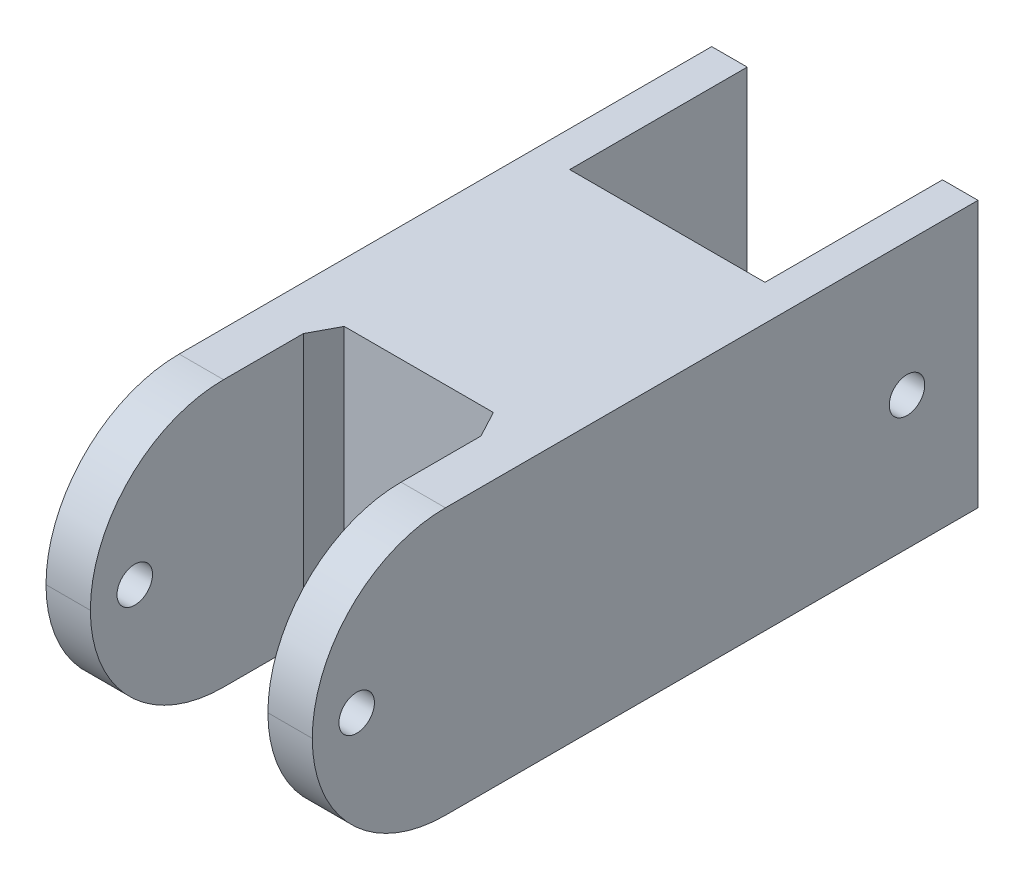
from build123d import *

# Parameters (mm, degrees)
SKETCH1_W                  = 38.1
SKETCH1_H                  = 38.1
PRONG_HOLDERS_DEPTH        = 19.05
SKETCH5_R                  = 2.54
SCREW_HOLDER_DEPTH         = 58.15
GROOVE_CUT_OUT_DEPTH       = 58.15
SKETCH6_W                  = 38.1
SKETCH6_H                  = 31.75
OPENING_OF_THE_TOP_DEPTH   = 66.991135768
ROUNDING_OFF_HODER_EDGES_R = 19.05
SKETCH7_W                  = 38.1
SKETCH7_H                  = 38.1
ADJUSTABLE_LENGTH_DEPTH    = 25.4
SKETCH8_W                  = 5.08
SKETCH8_H                  = 38.1
BOSS_EXTRUDE3_DEPTH        = 25.4
SKETCH9_R                  = 2.54
CUT_EXTRUDE4_DEPTH         = 99.578509321


with BuildPart() as part:
    # Sketch1 → Prong holders (new, symmetric)
    with BuildSketch(Plane(origin=(0, 0, 0), x_dir=(1, 0, 0), z_dir=(0, 1, 0))):
        with Locations((19.05, 19.05)):
            Rectangle(SKETCH1_W, SKETCH1_H)
    prong_holders = extrude(amount=PRONG_HOLDERS_DEPTH, both=True)

    # Sketch5 → Screw holder (cut, through all)
    with BuildSketch(Plane(origin=(38.1, 0, 0), x_dir=(0, 0, -1), z_dir=(1, 0, 0))):
        Circle(SKETCH5_R)
    screw_holder = extrude(amount=-SCREW_HOLDER_DEPTH, mode=Mode.SUBTRACT)

    # Sketch4 → Groove cut out (cut, symmetric)
    with BuildSketch(Plane(origin=(0, 0, 0), x_dir=(1, 0, 0), z_dir=(0, 1, 0))):
        Polygon((31.75, 24.13), (29.718, 27.94), (8.382, 27.94), (6.35, 24.13), (6.35, 0), (31.75, 0), align=None)
    groove_cut_out = extrude(amount=GROOVE_CUT_OUT_DEPTH, both=True, mode=Mode.SUBTRACT)

    # Mirror2: Prong holders, Screw holder, Groove cut out across plane
    add(prong_holders.mirror(Plane(origin=(0, 19.05, 0), x_dir=(1, 0, 0), z_dir=(0, 0, -1))))
    add(screw_holder.mirror(Plane(origin=(0, 19.05, 0), x_dir=(1, 0, 0), z_dir=(0, 0, -1))), mode=Mode.SUBTRACT)
    add(groove_cut_out.mirror(Plane(origin=(0, 19.05, 0), x_dir=(1, 0, 0), z_dir=(0, 0, -1))), mode=Mode.SUBTRACT)

    # Sketch6 → Opening of the top (cut, through all)
    with BuildSketch(Plane.XZ.offset(19.05)):
        with Locations((19.05, 22.225)):
            Rectangle(SKETCH6_W, SKETCH6_H)
    extrude(amount=-OPENING_OF_THE_TOP_DEPTH, mode=Mode.SUBTRACT)

    # Rounding off hoder edges
    rounding_off_hoder_edges_edges = [part.edges().sort_by_distance(p)[0] for p in [
        (3.175, 19.05, 6.35),
        (3.175, -19.05, 6.35),
        (34.925, -19.05, 6.35),
        (34.925, 19.05, 6.35),
    ]]
    fillet(rounding_off_hoder_edges_edges, radius=ROUNDING_OFF_HODER_EDGES_R - 0.0001)  # a hair under: the kernel refuses the full size

    # Sketch7 → Adjustable length (add)
    with BuildSketch(Plane(origin=(0, 0, -38.1), x_dir=(-1, 0, 0), z_dir=(0, 0, -1))):
        with Locations((-19.05, 0)):
            Rectangle(SKETCH7_W, SKETCH7_H)
    extrude(amount=ADJUSTABLE_LENGTH_DEPTH)

    # Sketch8 → Boss-Extrude3 (add)
    with BuildSketch(Plane(origin=(0, 0, -63.5), x_dir=(-1, 0, 0), z_dir=(0, 0, -1))):
        with Locations((-35.56, 0)):
            Rectangle(SKETCH8_W, SKETCH8_H)
        with Locations((-2.54, 0)):
            Rectangle(SKETCH8_W, SKETCH8_H)
    extrude(amount=BOSS_EXTRUDE3_DEPTH)

    # Sketch9 → Cut-Extrude4 (cut, through all)
    with BuildSketch(Plane(origin=(38.1, 0, 0), x_dir=(0, 0, -1), z_dir=(1, 0, 0))):
        with Locations((78.74, 0)):
            Circle(SKETCH9_R)
    extrude(amount=-CUT_EXTRUDE4_DEPTH, mode=Mode.SUBTRACT)


solid = part.part
